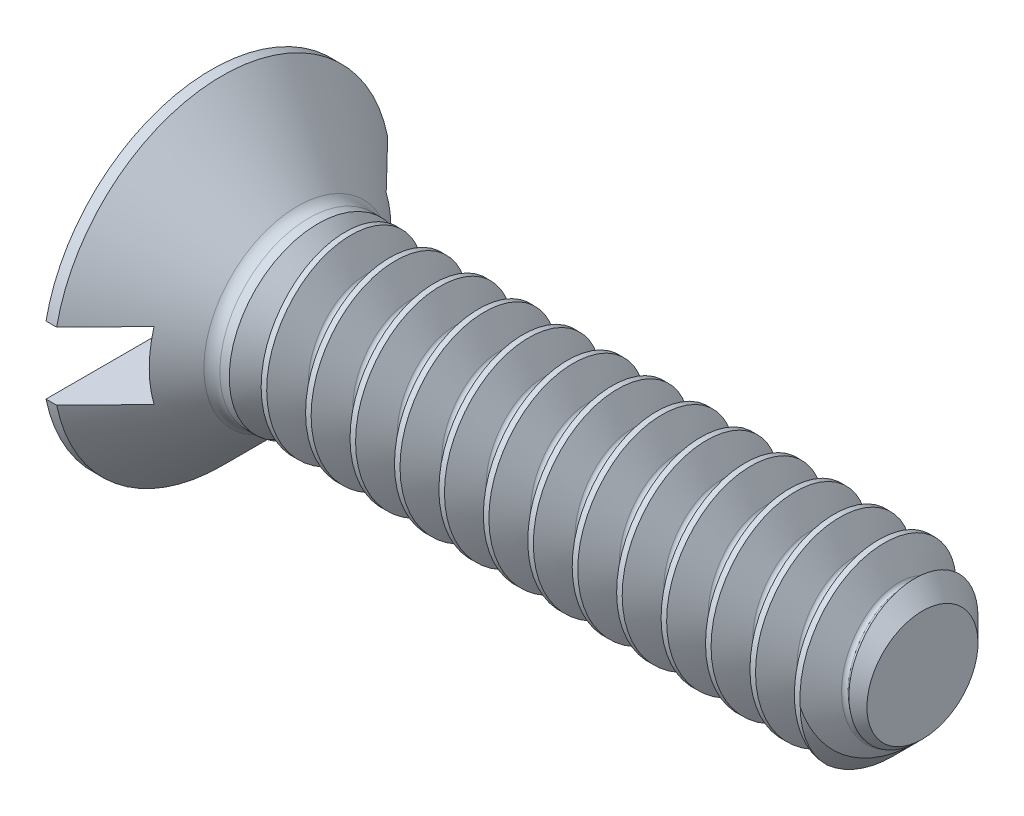
from build123d import *

# Parameters (mm, degrees)
CUT_EXTRUDE1_DEPTH      = 3.409356761
CUT_EXTRUDE1_DEPTH_BACK = 3.409356761
SKETCH3_W               = 0.33
SKETCH3_H               = 0.38
FILLET1_R               = 0.09
CHAMFER1_SIZE           = 0.1875
CUT_SWEEP1_PITCH        = 0.25
CUT_SWEEP1_TO           = 3.4


with BuildPart() as part:
    # Sketch2 → Revolve1 (revolve)
    with BuildSketch(Plane.XY, mode=Mode.PRIVATE) as revolve1_sk:
        Polygon((-2, 0), (2, 0), (2, 0.5), (-1.4, 0.5), (-1.49, 0.5), (-1.94, 0.95), (-2, 0.95), align=None)
    revolve(revolve1_sk.sketch.rotate(Axis((-2, 0, 0), (1, 0, 0)), 180), axis=Axis((-2, 0, 0), (1, 0, 0)))

    # Sketch3 → Cut-Extrude1 (cut, two sides: drawn at the far end of the back side and taken through both)
    with BuildSketch(Plane.XY.offset(-CUT_EXTRUDE1_DEPTH_BACK)):
        with Locations((-1.835, 0)):
            Rectangle(SKETCH3_W, SKETCH3_H)
    extrude(amount=CUT_EXTRUDE1_DEPTH + CUT_EXTRUDE1_DEPTH_BACK, mode=Mode.SUBTRACT)

    # Fillet1
    fillet1_edges = [part.edges().sort_by_distance(p)[0] for p in [
        (-1.49, 0.5, 0),
    ]]
    fillet(fillet1_edges, radius=FILLET1_R)


with BuildPart() as body_2:
    # Split1: the piece on the far side of the plane
    add(part.part)
    split(bisect_by=Plane(origin=(-1.4, 0, 0), x_dir=(0, 0, 1), z_dir=(1, 0, 0)), keep=Keep.BOTTOM)


with BuildPart() as part_1:
    add(part.part)

    # Split1
    split(bisect_by=Plane(origin=(-1.4, 0, 0), x_dir=(0, 0, 1), z_dir=(1, 0, 0)), keep=Keep.TOP)

    # Chamfer1
    chamfer1_edges = [part_1.edges().sort_by_distance(p)[0] for p in [
        (2, 0.5, 0),
    ]]
    chamfer(chamfer1_edges, length=CHAMFER1_SIZE)

    # Cut-Sweep1: arcs per turn and ends read off the stored shape
    # Cut-Sweep1: the profile of Sketch8 screwed along a right-hand helix through 16 turns, 6 arcs to a turn; built about Z, then put on its axis
    cut_sweep1_z = Axis((0, 0, 0), (0, 0, 1))
    cut_sweep1_corners = [(0.351151884, 0, -0.1328125), (0.527063294, 0, -0.234375), (0.513531647, 0, 0.0078125), (0.351151884, 0, -0.0859375), (0.337620237, 0, -0.109375)]
    with BuildLine(mode=Mode.PRIVATE) as cut_sweep1_profile:
        Line(cut_sweep1_corners[0], cut_sweep1_corners[1])
        Line(cut_sweep1_corners[1], cut_sweep1_corners[2])
        Line(cut_sweep1_corners[2], cut_sweep1_corners[3])
        ThreePointArc((0.351151884, 0, -0.0859375), (0.341246031, 0, -0.095843353), (0.337620237, 0, -0.109375))
        ThreePointArc((0.337620237, 0, -0.109375), (0.341246031, 0, -0.122906647), (0.351151884, 0, -0.1328125))
    cut_sweep1_cap = Face(cut_sweep1_profile.wire())
    cut_sweep1_arcs = [((0.351151884, 0, -0.0859375), (0.337620237, 0, -0.09375), (0.337620237, 0, -0.109375), (1, 0.8660254037844352, 1)), ((0.337620237, 0, -0.109375), (0.337620237, 0, -0.125), (0.351151884, 0, -0.1328125), (1, 0.8660254037844437, 1))]  # start, shoulder, end, weights
    cut_sweep1_turn_angles = [0, 30, 60, 90, 120, 150, 180, 210, 240, 270, 300, 330, 360]
    cut_sweep1_turn_weights = [1, 0.8660254037844387, 1, 0.8660254037844387, 1, 0.8660254037844387, 1, 0.8660254037844387, 1, 0.8660254037844387, 1, 0.8660254037844387, 1]
    cut_sweep1_turn_rails = [Edge.make_bspline([Vector(p[0], p[1], 0).rotate(cut_sweep1_z, cut_sweep1_turn_angles[k]) / cut_sweep1_turn_weights[k] + Vector(0, 0, p[2] + CUT_SWEEP1_PITCH * cut_sweep1_turn_angles[k] / 360) for k in range(13)], [0, 0, 0, 1, 1, 2, 2, 3, 3, 4, 4, 5, 5, 6, 6, 6], 2, cut_sweep1_turn_weights) for p in cut_sweep1_corners]
    cut_sweep1_turn_sides = [*[Face.make_surface_from_curves(cut_sweep1_turn_rails[p[0]], cut_sweep1_turn_rails[p[1]]) for p in [(0, 1), (1, 2), (2, 3)]], *[Face.make_bezier_surface([[Vector(p[j][0], p[j][1], 0).rotate(cut_sweep1_z, cut_sweep1_turn_angles[2 * i + k]) / cut_sweep1_turn_weights[2 * i + k] + Vector(0, 0, p[j][2] + CUT_SWEEP1_PITCH * cut_sweep1_turn_angles[2 * i + k] / 360) for k in range(3)] for j in range(3)], [[p[3][j] * cut_sweep1_turn_weights[2 * i + k] for k in range(3)] for j in range(3)]) for p in cut_sweep1_arcs for i in range(6)]]
    cut_sweep1 = Plane(origin=(2, 0, 0), x_dir=(0, 1, 0), z_dir=(-1, 0, 0)) * split(Solid(Shell([*[p.moved(Location((0, 0, CUT_SWEEP1_PITCH * i))) for i in range(16) for p in cut_sweep1_turn_sides], cut_sweep1_cap, cut_sweep1_cap.rotate(cut_sweep1_z, 5760).moved(Location((0, 0, CUT_SWEEP1_PITCH * 5760 / 360)))])), bisect_by=Plane.XY.offset(CUT_SWEEP1_TO), keep=Keep.BOTTOM, mode=Mode.PRIVATE)
    add(cut_sweep1, mode=Mode.SUBTRACT)

    add(body_2.part)  # Boss-Extrude1 merges body 2
    # Boss-Extrude1: read off the stored shape, not the designer's step
    # Boss-Extrude1 outline → Boss-Extrude1 (revolve)
    with BuildSketch(Plane.YX):
        Polygon((0.5, -1.4), (0.337620237, -1.237620237), (0.337620237, -1.4), align=None)
    revolve(axis=Axis((0, 0, 0), (1, 0, 0)))


solid = part_1.part
